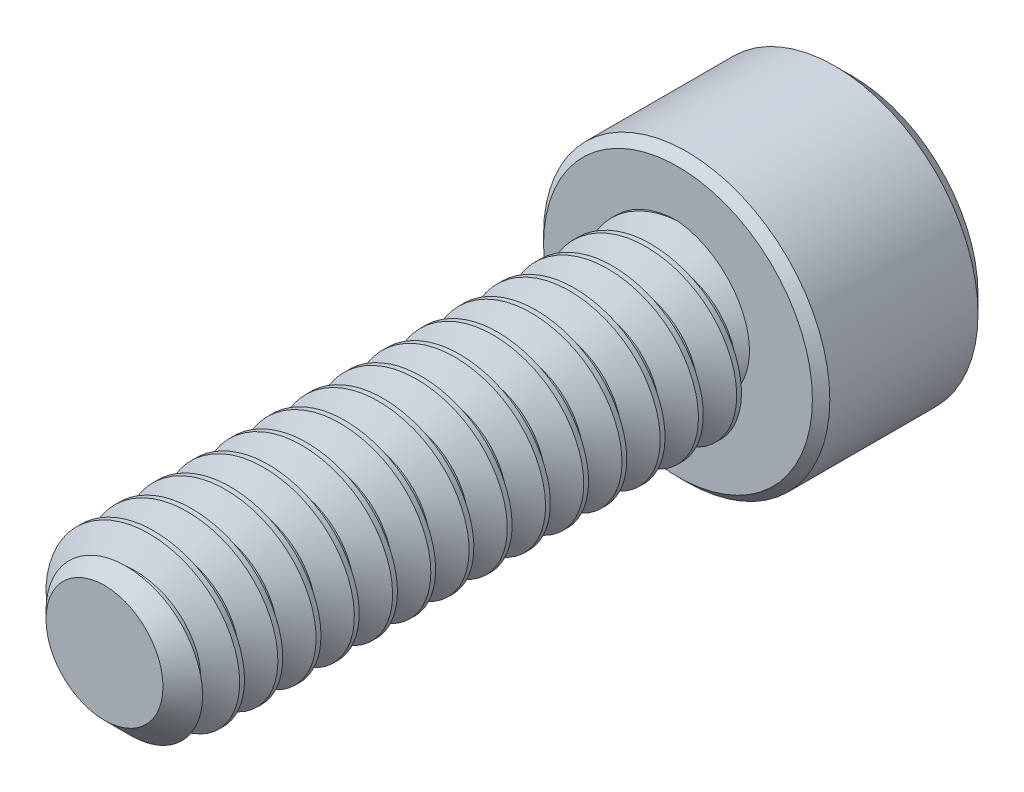
from build123d import *

# Parameters (mm, degrees)
SKETCH1_R          = 2.413
EXTRUDE1_DEPTH     = 15.875
CHAMFER3_SIZE      = 0.79375
CUT_SWEEP1_PITCH   = 1.058333333
SKETCH6_R          = 3.9624
EXTRUDE2_DEPTH     = 4.826
CUT_EXTRUDE1_DEPTH = 2.9765625
SKETCH8_R          = 2.291358881
CUT_EXTRUDE2_DEPTH = 0.4826
CUT_EXTRUDE2_DRAFT = -45
CHAMFER1_SIZE      = 0.4826
CHAMFER2_SIZE      = 0.2413


with BuildPart() as part:
    # Sketch1 → Extrude1 (new body)
    with BuildSketch(Plane.XY):
        Circle(SKETCH1_R)
    extrude(amount=-EXTRUDE1_DEPTH)

    # Chamfer3
    chamfer3_edges = [part.edges().sort_by_distance(p)[0] for p in [
        (-2.413, 0, 0),
    ]]
    chamfer(chamfer3_edges, length=CHAMFER3_SIZE)

    # Cut-Sweep1: the profile of Sketch3 profile screwed along a right-hand helix of 16 turns, 6 arcs to a turn; built about Z, then put on its axis
    cut_sweep1_z = Axis((0, 0, 0), (0, 0, 1))
    cut_sweep1_corners = [(2.4133, 0, -0.926214872), (1.725592336, 0, -0.529166667), (1.725592336, 0, -0.396875), (2.4133, 0, 0.000173205)]
    with BuildLine(mode=Mode.PRIVATE) as cut_sweep1_profile:
        Line(cut_sweep1_corners[0], cut_sweep1_corners[1])
        Line(cut_sweep1_corners[1], cut_sweep1_corners[2])
        Line(cut_sweep1_corners[2], cut_sweep1_corners[3])
        Line(cut_sweep1_corners[3], cut_sweep1_corners[0])
    cut_sweep1_cap = Face(cut_sweep1_profile.wire())
    cut_sweep1_turn_angles = [0, 30, 60, 90, 120, 150, 180, 210, 240, 270, 300, 330, 360]
    cut_sweep1_turn_weights = [1, 0.8660254037844387, 1, 0.8660254037844387, 1, 0.8660254037844387, 1, 0.8660254037844387, 1, 0.8660254037844387, 1, 0.8660254037844387, 1]
    cut_sweep1_turn_rails = [Edge.make_bspline([Vector(p[0], p[1], 0).rotate(cut_sweep1_z, cut_sweep1_turn_angles[k]) / cut_sweep1_turn_weights[k] + Vector(0, 0, p[2] + CUT_SWEEP1_PITCH * cut_sweep1_turn_angles[k] / 360) for k in range(13)], [0, 0, 0, 1, 1, 2, 2, 3, 3, 4, 4, 5, 5, 6, 6, 6], 2, cut_sweep1_turn_weights) for p in cut_sweep1_corners]
    cut_sweep1_turn_sides = [Face.make_surface_from_curves(cut_sweep1_turn_rails[p[0]], cut_sweep1_turn_rails[p[1]]) for p in [(0, 1), (1, 2), (2, 3), (3, 0)]]
    cut_sweep1 = Plane(origin=(0, 0, 0), x_dir=(0, 1, 0), z_dir=(0, 0, -1)) * Solid(Shell([*[p.moved(Location((0, 0, CUT_SWEEP1_PITCH * i))) for i in range(16) for p in cut_sweep1_turn_sides], cut_sweep1_cap, cut_sweep1_cap.rotate(cut_sweep1_z, 5760).moved(Location((0, 0, CUT_SWEEP1_PITCH * 5760 / 360)))]))
    add(cut_sweep1, mode=Mode.SUBTRACT)

    # Sketch6 → Extrude2 (add)
    with BuildSketch(Plane(origin=(0, 0, -15.875), x_dir=(-1, 0, 0), z_dir=(0, 0, -1))):
        Circle(SKETCH6_R)
    extrude(amount=EXTRUDE2_DEPTH)

    # Sketch7 → Cut-Extrude1 (cut)
    with BuildSketch(Plane(origin=(0, 0, -20.701), x_dir=(-1, 0, 0), z_dir=(0, 0, -1))):
        Polygon((0, 2.291358881), (-1.984375, 1.14567944), (-1.984375, -1.14567944), (0, -2.291358881), (1.984375, -1.14567944), (1.984375, 1.14567944), align=None)
    extrude(amount=-CUT_EXTRUDE1_DEPTH, mode=Mode.SUBTRACT)


with BuildPart() as cut_extrude2_tool:
    # Sketch8 → Cut-Extrude2 (with draft: the straight prism first)
    with BuildSketch(Plane(origin=(0, 0, -20.701), x_dir=(-1, 0, 0), z_dir=(0, 0, -1))):
        Circle(SKETCH8_R)
    extrude(amount=-CUT_EXTRUDE2_DEPTH)
    # Cut-Extrude2: the draft: its side faces are tilted about the plane it starts from
    cut_extrude2_sides = [cut_extrude2_tool.faces().sort_by_distance(p)[0] for p in [
        (2.291358881, 0, -20.4597),
    ]]
    draft(cut_extrude2_sides, Plane(origin=(0, 0, -20.701), x_dir=(-1, 0, 0), z_dir=(0, 0, -1)), CUT_EXTRUDE2_DRAFT)


with BuildPart() as part_1:
    add(part.part)

    # Cut-Extrude2: cut by cut_extrude2_tool
    add(cut_extrude2_tool.part, mode=Mode.SUBTRACT)

    # Chamfer1
    chamfer1_edges = [part_1.edges().sort_by_distance(p)[0] for p in [
        (3.9624, 0, -20.701),
    ]]
    chamfer(chamfer1_edges, length=CHAMFER1_SIZE)

    # Chamfer2
    chamfer2_edges = [part_1.edges().sort_by_distance(p)[0] for p in [
        (3.9624, 0, -15.875),
    ]]
    chamfer(chamfer2_edges, length=CHAMFER2_SIZE)


solid = part_1.part
